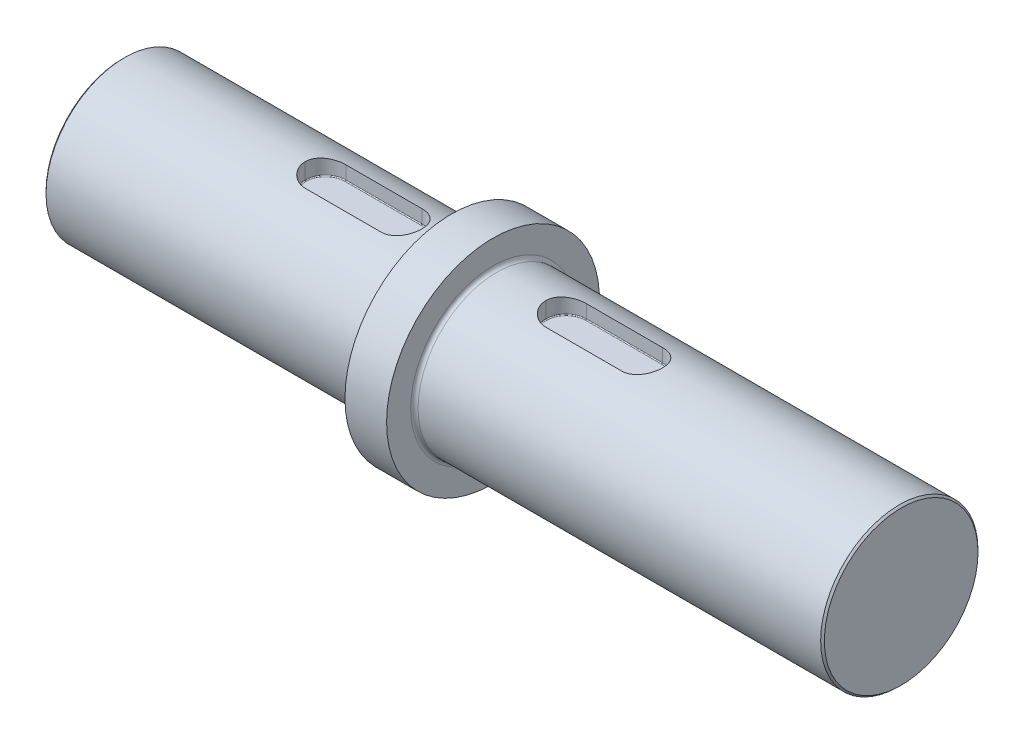
from build123d import *

# Parameters (mm, degrees)
TAGLIO_ESTRUSIONE1_DEPTH      = 11
TAGLIO_ESTRUSIONE1_DEPTH_BACK = 11
SCHIZZO2_W                    = 63
SCHIZZO2_H                    = 14
RACCORDO1_R                   = 0.5
RACCORDO2_R                   = 11
ESTRUSIONE_ESTRUSIONE1_START  = 30
SCHIZZO3_R                    = 42.5
ESTRUSIONE_ESTRUSIONE1_DEPTH  = 30
SCHIZZO4_R                    = 42.5
ESTRUSIONE_ESTRUSIONE2_DEPTH  = 12
RACCORDO3_R                   = 2
SMUSSO1_SIZE                  = 1


with BuildPart() as part:
    # Schizzo1 → Rivoluzione1 (revolve)
    with BuildSketch(Plane.XY, mode=Mode.PRIVATE) as rivoluzione1_sk:
        Polygon((0, 0), (0, 42.5), (165.5, 42.5), (165.5, 57.5), (188, 57.5), (188, 42.5), (378.5, 42.5), (378.5, 0), align=None)
    revolve(rivoluzione1_sk.sketch.rotate(Axis((-146.856788593, 0, 0), (1, 0, 0)), 90), axis=Axis((-146.856788593, 0, 0), (1, 0, 0)))

    # Schizzo2 → Taglio-Estrusione1 (cut, two sides: drawn at the far end of the back side and taken through both)
    with BuildSketch(Plane.XY.offset(-TAGLIO_ESTRUSIONE1_DEPTH_BACK)):
        with Locations((118, 40.5)):
            Rectangle(SCHIZZO2_W, SCHIZZO2_H)
        with Locations((248, 40.5)):
            Rectangle(SCHIZZO2_W, SCHIZZO2_H)
    extrude(amount=TAGLIO_ESTRUSIONE1_DEPTH + TAGLIO_ESTRUSIONE1_DEPTH_BACK, mode=Mode.SUBTRACT)

    # Raccordo1
    raccordo1_edges = [part.edges().sort_by_distance(p)[0] for p in [
        (149.5, 33.5, 0),
        (118, 33.5, 11),
        (86.5, 33.5, 0),
        (118, 33.5, -11),
        (279.5, 33.5, 0),
        (248, 33.5, 11),
        (216.5, 33.5, 0),
        (248, 33.5, -11),
    ]]
    fillet(raccordo1_edges, radius=RACCORDO1_R)

    # Raccordo2
    # the kernel refuses this fillet: 11 mm, written as the material it adds along each edge
    with BuildSketch(Plane(origin=(268.5, 33.5, 0), x_dir=(0, 0, -1), z_dir=(-1, 0, 0))) as raccordo2_piece_1:
        with BuildLine():
            CenterArc((10.5, -0.5), 0.5, 0, 90)
            Line((11, -0.5), (11, 0))
            Line((11, 0), (10.5, 0))
        make_face()
    revolve(axis=Axis((268.5, 33.5, 0), (0, -1, 0)), revolution_arc=90)
    with BuildSketch(Plane(origin=(268.5, 33.5, 0), x_dir=(1, 0, 0), z_dir=(0, 0, -1))) as raccordo2_piece_2:
        with BuildLine():
            CenterArc((10.5, -0.5), 0.5, 0, 90)
            Line((11, -0.5), (11, 0))
            Line((11, 0), (10.5, 0))
        make_face()
    revolve(axis=Axis((268.5, 33.5, 0), (0, -1, 0)), revolution_arc=90)
    with BuildSketch(Plane(origin=(227.5, 33.5, 0), x_dir=(0, 0, 1), z_dir=(1, 0, 0))) as raccordo2_piece_3:
        with BuildLine():
            CenterArc((10.5, -0.5), 0.5, 0, 90)
            Line((11, -0.5), (11, 0))
            Line((11, 0), (10.5, 0))
        make_face()
    revolve(axis=Axis((227.5, 33.5, 0), (0, -1, 0)), revolution_arc=90)
    with BuildSketch(Plane(origin=(227.5, 33.5, 0), x_dir=(-1, 0, 0), z_dir=(0, 0, 1))) as raccordo2_piece_4:
        with BuildLine():
            CenterArc((10.5, -0.5), 0.5, 0, 90)
            Line((11, -0.5), (11, 0))
            Line((11, 0), (10.5, 0))
        make_face()
    revolve(axis=Axis((227.5, 33.5, 0), (0, -1, 0)), revolution_arc=90)
    with BuildSketch(Plane(origin=(138.5, 33.5, 0), x_dir=(1, 0, 0), z_dir=(0, 0, -1))) as raccordo2_piece_5:
        with BuildLine():
            CenterArc((10.5, -0.5), 0.5, 0, 90)
            Line((11, -0.5), (11, 0))
            Line((11, 0), (10.5, 0))
        make_face()
    revolve(axis=Axis((138.5, 33.5, 0), (0, -1, 0)), revolution_arc=90)
    with BuildSketch(Plane(origin=(138.5, 33.5, 0), x_dir=(0, 0, -1), z_dir=(-1, 0, 0))) as raccordo2_piece_6:
        with BuildLine():
            CenterArc((10.5, -0.5), 0.5, 0, 90)
            Line((11, -0.5), (11, 0))
            Line((11, 0), (10.5, 0))
        make_face()
    revolve(axis=Axis((138.5, 33.5, 0), (0, -1, 0)), revolution_arc=90)
    with BuildSketch(Plane(origin=(97.5, 33.5, 0), x_dir=(0, 0, 1), z_dir=(1, 0, 0))) as raccordo2_piece_7:
        with BuildLine():
            CenterArc((10.5, -0.5), 0.5, 0, 90)
            Line((11, -0.5), (11, 0))
            Line((11, 0), (10.5, 0))
        make_face()
    revolve(axis=Axis((97.5, 33.5, 0), (0, -1, 0)), revolution_arc=90)
    with BuildSketch(Plane(origin=(97.5, 33.5, 0), x_dir=(-1, 0, 0), z_dir=(0, 0, 1))) as raccordo2_piece_8:
        with BuildLine():
            CenterArc((10.5, -0.5), 0.5, 0, 90)
            Line((11, -0.5), (11, 0))
            Line((11, 0), (10.5, 0))
        make_face()
    revolve(axis=Axis((97.5, 33.5, 0), (0, -1, 0)), revolution_arc=90)
    with BuildSketch(Plane(origin=(86.5, 33.5, -11), x_dir=(0, 0, 1), z_dir=(0, 1, 0))) as raccordo2_piece_9_section:
        with BuildLine():
            CenterArc((RACCORDO2_R, RACCORDO2_R), RACCORDO2_R, 180, 90)
            Line((0, RACCORDO2_R), (0, 0))
            Line((0, 0), (RACCORDO2_R, 0))
        make_face()
    raccordo2_piece_9 = extrude(amount=35.05179655, mode=Mode.PRIVATE)
    raccordo2_piece_9 = raccordo2_piece_9 & Plane(origin=(88.913570228, 0, 0), x_dir=(0, 0, 1), z_dir=(1, 0, 0)) * Cylinder(42.5, 115, mode=Mode.PRIVATE)
    add(raccordo2_piece_9)
    with BuildSketch(Plane(origin=(86.5, 33.5, 11), x_dir=(0, 0, -1), z_dir=(0, 1, 0))) as raccordo2_piece_10_section:
        with BuildLine():
            CenterArc((RACCORDO2_R, -RACCORDO2_R), RACCORDO2_R, 90, 90)
            Line((0, -RACCORDO2_R), (0, 0))
            Line((0, 0), (RACCORDO2_R, 0))
        make_face()
    raccordo2_piece_10 = extrude(amount=35.05179655, mode=Mode.PRIVATE)
    raccordo2_piece_10 = raccordo2_piece_10 & Plane(origin=(88.913567526, 0, 0), x_dir=(0, 0, 1), z_dir=(1, 0, 0)) * Cylinder(42.5, 115, mode=Mode.PRIVATE)
    add(raccordo2_piece_10)
    with BuildSketch(Plane(origin=(149.5, 68.55179655, -11), x_dir=(-1, 0, 0), z_dir=(0, -1, 0))) as raccordo2_piece_11_section:
        with BuildLine():
            CenterArc((RACCORDO2_R, -RACCORDO2_R), RACCORDO2_R, 90, 90)
            Line((0, -RACCORDO2_R), (0, 0))
            Line((0, 0), (RACCORDO2_R, 0))
        make_face()
    raccordo2_piece_11 = extrude(amount=35.05179655, mode=Mode.PRIVATE)
    raccordo2_piece_11 = raccordo2_piece_11 & Plane(origin=(147.086427886, 0, 0), x_dir=(0, 0, 1), z_dir=(1, 0, 0)) * Cylinder(42.5, 115, mode=Mode.PRIVATE)
    add(raccordo2_piece_11)
    with BuildSketch(Plane(origin=(149.5, 68.55179655, 11), x_dir=(-1, 0, 0), z_dir=(0, -1, 0))) as raccordo2_piece_12_section:
        with BuildLine():
            CenterArc((RACCORDO2_R, RACCORDO2_R), RACCORDO2_R, 180, 90)
            Line((0, RACCORDO2_R), (0, 0))
            Line((0, 0), (RACCORDO2_R, 0))
        make_face()
    raccordo2_piece_12 = extrude(amount=35.05179655, mode=Mode.PRIVATE)
    raccordo2_piece_12 = raccordo2_piece_12 & Plane(origin=(147.086433525, 0, 0), x_dir=(0, 0, 1), z_dir=(1, 0, 0)) * Cylinder(42.5, 115, mode=Mode.PRIVATE)
    add(raccordo2_piece_12)
    with BuildSketch(Plane(origin=(216.5, 33.5, -11), x_dir=(0, 0, 1), z_dir=(0, 1, 0))) as raccordo2_piece_13_section:
        with BuildLine():
            CenterArc((RACCORDO2_R, RACCORDO2_R), RACCORDO2_R, 180, 90)
            Line((0, RACCORDO2_R), (0, 0))
            Line((0, 0), (RACCORDO2_R, 0))
        make_face()
    raccordo2_piece_13 = extrude(amount=35.05179655, mode=Mode.PRIVATE)
    raccordo2_piece_13 = raccordo2_piece_13 & Plane(origin=(218.913570228, 0, 0), x_dir=(0, 0, 1), z_dir=(1, 0, 0)) * Cylinder(42.5, 115, mode=Mode.PRIVATE)
    add(raccordo2_piece_13)
    with BuildSketch(Plane(origin=(216.5, 33.5, 11), x_dir=(0, 0, -1), z_dir=(0, 1, 0))) as raccordo2_piece_14_section:
        with BuildLine():
            CenterArc((RACCORDO2_R, -RACCORDO2_R), RACCORDO2_R, 90, 90)
            Line((0, -RACCORDO2_R), (0, 0))
            Line((0, 0), (RACCORDO2_R, 0))
        make_face()
    raccordo2_piece_14 = extrude(amount=35.05179655, mode=Mode.PRIVATE)
    raccordo2_piece_14 = raccordo2_piece_14 & Plane(origin=(218.913567526, 0, 0), x_dir=(0, 0, 1), z_dir=(1, 0, 0)) * Cylinder(42.5, 115, mode=Mode.PRIVATE)
    add(raccordo2_piece_14)
    with BuildSketch(Plane(origin=(279.5, 68.55179655, 11), x_dir=(-1, 0, 0), z_dir=(0, -1, 0))) as raccordo2_piece_15_section:
        with BuildLine():
            CenterArc((RACCORDO2_R, RACCORDO2_R), RACCORDO2_R, 180, 90)
            Line((0, RACCORDO2_R), (0, 0))
            Line((0, 0), (RACCORDO2_R, 0))
        make_face()
    raccordo2_piece_15 = extrude(amount=35.05179655, mode=Mode.PRIVATE)
    raccordo2_piece_15 = raccordo2_piece_15 & Plane(origin=(277.086433525, 0, 0), x_dir=(0, 0, 1), z_dir=(1, 0, 0)) * Cylinder(42.5, 115, mode=Mode.PRIVATE)
    add(raccordo2_piece_15)
    with BuildSketch(Plane(origin=(279.5, 68.55179655, -11), x_dir=(0, 0, 1), z_dir=(0, -1, 0))) as raccordo2_piece_16_section:
        with BuildLine():
            CenterArc((RACCORDO2_R, RACCORDO2_R), RACCORDO2_R, 180, 90)
            Line((0, RACCORDO2_R), (0, 0))
            Line((0, 0), (RACCORDO2_R, 0))
        make_face()
    raccordo2_piece_16 = extrude(amount=35.05179655, mode=Mode.PRIVATE)
    raccordo2_piece_16 = raccordo2_piece_16 & Plane(origin=(277.086429772, 0, 0), x_dir=(0, 0, 1), z_dir=(1, 0, 0)) * Cylinder(42.5, 115, mode=Mode.PRIVATE)
    add(raccordo2_piece_16)

    # Schizzo3 → Estrusione-Estrusione1 (add)
    with BuildSketch(Plane(origin=(378.5, 0, 0), x_dir=(0, 0, -1), z_dir=(1, 0, 0)).offset(ESTRUSIONE_ESTRUSIONE1_START)):
        with Locations(Location((0, 0, 0), (0, 0, 180))):
            Circle(SCHIZZO3_R)
    extrude(amount=-ESTRUSIONE_ESTRUSIONE1_DEPTH)

    # Schizzo4 → Estrusione-Estrusione2 (add)
    with BuildSketch(Plane.ZY):
        Circle(SCHIZZO4_R)
    extrude(amount=ESTRUSIONE_ESTRUSIONE2_DEPTH)

    # Raccordo3
    raccordo3_edges = [part.edges().sort_by_distance(p)[0] for p in [
        (188, 0, -42.5),
        (165.5, 0, -42.5),
    ]]
    fillet(raccordo3_edges, radius=RACCORDO3_R)

    # Smusso1
    smusso1_edges = [part.edges().sort_by_distance(p)[0] for p in [
        (408.5, 0, -42.5),
        (-12, 0, -42.5),
    ]]
    chamfer(smusso1_edges, length=SMUSSO1_SIZE)


solid = part.part
